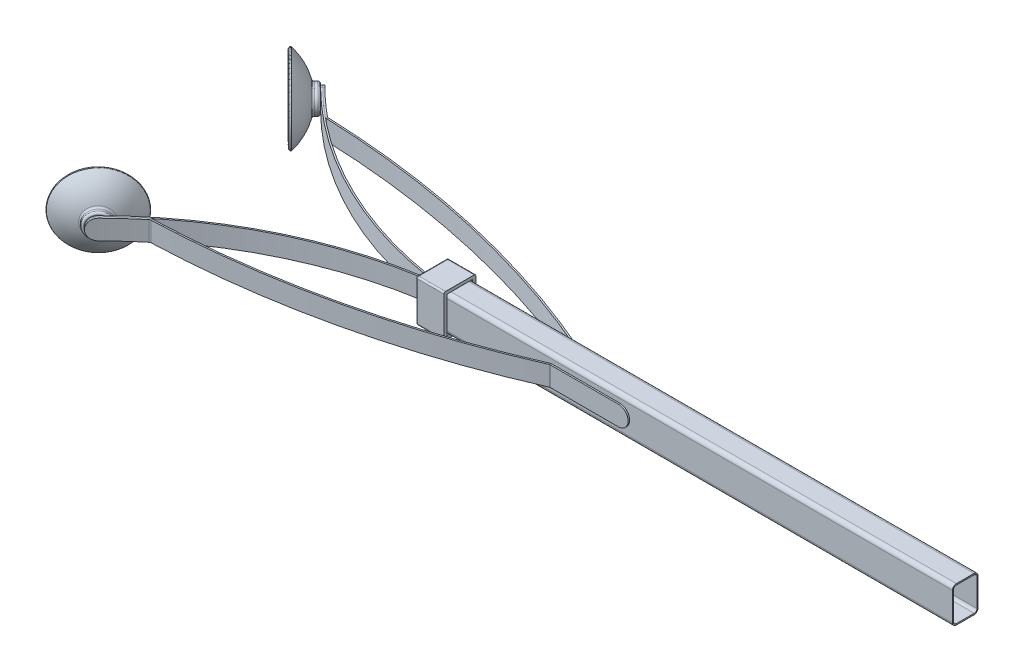
from build123d import *

# Parameters (mm, degrees)
BASE_FLANGE1_DEPTH  = 5
BASE_FLANGE2_START  = -5
BASE_FLANGE2_DEPTH  = 10
FILLET8_RADIUS      = 5
FILLET8_LENGTH      = 0.79375
FILLET1_R           = 5
FILLET2_R           = 5
FILLET3_R           = 1
FILLET4_R           = 0.5
SKETCH10_W          = 13
SKETCH10_H          = 18.3
SKETCH10_W_2        = 12
SKETCH10_H_2        = 17
BOSS_EXTRUDE1_DEPTH = 270
FILLET7_R           = 1.4
FILLET5_R           = 2
SKETCH11_W          = 16.175
SKETCH11_H          = 21.475
SKETCH11_W_2        = 13
SKETCH11_H_2        = 18.3
BOSS_EXTRUDE2_DEPTH = 12.7
SKETCH11_2_W        = 16.175
SKETCH11_2_H        = 21.475
SKETCH11_2_W_2      = 13
SKETCH11_2_H_2      = 18.3
BOSS_EXTRUDE3_DEPTH = 1.5875
SKETCH14_W          = 6.35
SKETCH14_H          = 11
CUT_EXTRUDE1_DEPTH  = 280.307383352
FILLET6_R           = 0.79375


# Read off the part's stored shape, not the designer's step: Base-Flange2
# Sheet-metal steps are written as plain solids
with BuildPart() as part:
    # Sketch1 → Base-Flange1 (new, symmetric)
    with BuildSketch(Plane(origin=(0, 0, 0), x_dir=(1, 0, 0), z_dir=(0, 1, 0))):
        with BuildLine():
            ThreePointArc((-3.499218789, 60.722026783), (-1.760773287, 58.925077051), (0, 57.15))
            ThreePointArc((0, 57.15), (55.11365592, 18.314959936), (120, 0))
            Line((120, 0), (119.916223127, -0.789316475))
            ThreePointArc((119.916223127, -0.789316475), (54.772361369, 17.598330958), (-0.560026873, 56.587497587))
            ThreePointArc((-0.560026873, 56.587497587), (-2.327788228, 58.369619475), (-4.073133186, 60.173700852))
            Line((-4.073133186, 60.173700852), (-3.499218789, 60.722026783))
        make_face()
    extrude(amount=BASE_FLANGE1_DEPTH, both=True)

    # Fillet1
    fillet1_edges = [part.edges().sort_by_distance(p)[0] for p in [
        (-3.786175987, 5, -60.447863818),
        (-3.786175987, -5, -60.447863818),
    ]]
    fillet(fillet1_edges, radius=FILLET1_R - 0.0001)  # a hair under: the kernel refuses the full size


with BuildPart() as body_2:
    # Base-Flange2 outline → Base-Flange2 (new body)
    with BuildSketch(Plane(origin=(0, 0, 0), x_dir=(1, 0, 0), z_dir=(0, 1, 0)).offset(BASE_FLANGE2_START)):
        with BuildLine():
            Line((180.293144329, 6.5), (219.916223127, 6.5))
            Line((219.916223127, 6.5), (219.916223127, 7.29375))
            Line((219.916223127, 7.29375), (180.293144329, 7.29375))
            ThreePointArc((180.293144329, 7.29375), (180.087709299, 7.315079244), (179.891037816, 7.378157103))
            ThreePointArc((179.891037816, 7.378157103), (99.115322291, 34.084810703), (14.760378946, 45.139452184))
            ThreePointArc((14.760378946, 45.139452184), (14.440735605, 45.204111823), (14.158894169, 45.368179309))
            ThreePointArc((14.158894169, 45.368179309), (5.383698882, 53.068843736), (-2.925304391, 61.270352715))
            Line((-2.925304391, 61.270352715), (-3.499218789, 60.722026783))
            ThreePointArc((-3.499218789, 60.722026783), (4.842892238, 52.487838369), (13.65305285, 44.756490154))
            ThreePointArc((13.65305285, 44.756490154), (14.158605925, 44.462194101), (14.731966169, 44.346210873))
            ThreePointArc((14.731966169, 44.346210873), (98.938378759, 33.311034218), (179.571865772, 6.651405242))
            ThreePointArc((179.571865772, 6.651405242), (179.924645244, 6.538259332), (180.293144329, 6.5))
        make_face()
    extrude(amount=BASE_FLANGE2_DEPTH)

    # Fillet8: full round fillet: the end face becomes a half cylinder, R = half its width
    fillet8_face = Plane((219.916223127, 0, -6.896875), x_dir=(0, 0, -1), z_dir=(1, 0, 0))  # on the end face: x along it, z out of the body
    fillet8_slab = fillet8_face.offset(-FILLET8_RADIUS / 2) * Box(FILLET8_LENGTH, 2 * FILLET8_RADIUS, FILLET8_RADIUS, mode=Mode.PRIVATE)  # the body's end, R deep
    fillet8_round = Plane((214.916223127, 0, -6.896875), x_dir=(1, 0, 0), z_dir=(0, 0, -1)) * Cylinder(FILLET8_RADIUS, FILLET8_LENGTH, mode=Mode.PRIVATE)  # its axis R under the face
    add(fillet8_slab - fillet8_round, mode=Mode.SUBTRACT)

    # Fillet2
    fillet2_edges = [body_2.edges().sort_by_distance(p)[0] for p in [
        (-3.21226159, -5, -60.996189749),
        (-3.21226159, 5, -60.996189749),
    ]]
    fillet(fillet2_edges, radius=FILLET2_R - 0.0001)  # a hair under: the kernel refuses the full size


with BuildPart() as body_3:
    # Sketch9 → Revolve1 (revolve)
    with BuildSketch(Plane(origin=(0, 0, 0), x_dir=(1, 0, 0), z_dir=(0, 1, 0))):
        with BuildLine():
            Line((-7.176683174, 58.941719198), (-5.060046175, 61.067712569))
            Line((-5.060046175, 61.067712569), (-0.560026873, 56.587497587))
            Line((-0.560026873, 56.587497587), (-1.680080618, 55.462492762))
            Line((-1.680080618, 55.462492762), (-5.055095095, 58.822653998))
            Line((-5.055095095, 58.822653998), (-6.942115395, 56.927292322))
            ThreePointArc((-6.942115395, 56.927292322), (-13.941651318, 60.05442689), (-21.572077425, 60.795420258))
            Line((-21.572077425, 60.795420258), (-21.674985128, 62.379581315))
            ThreePointArc((-21.674985128, 62.379581315), (-14.16807269, 61.747693122), (-7.176683174, 58.941719198))
        make_face()
    revolve(axis=Axis((-0.560026873, 0, -56.587497587), (-0.7055456663995247, 0, 0.7086644570068762)))

    # Fillet3
    fillet3_edges = [body_3.edges().sort_by_distance(p)[0] for p in [
        (1.82335543, 0, -49.981289235),
        (-0.192086442, 0, -50.20696985),
        (1.694933858, 0, -52.102331526),
        (3.939992429, 0, -52.107282606),
    ]]
    fillet(fillet3_edges, radius=FILLET3_R)

    # Fillet4
    fillet4_edges = [body_3.edges().sort_by_distance(p)[0] for p in [
        (5.325130684, 0, -35.498291425),
        (3.740531149, 0, -35.594210986),
    ]]
    fillet(fillet4_edges, radius=FILLET4_R)


with BuildPart() as body_4:
    # Sketch10 → Boss-Extrude1 (new body)
    with BuildSketch(Plane(origin=(114.3, 0, 0), x_dir=(0, 0, -1), z_dir=(1, 0, 0))):
        Rectangle(SKETCH10_W, SKETCH10_H)
        Rectangle(SKETCH10_W_2, SKETCH10_H_2, mode=Mode.SUBTRACT)
    extrude(amount=BOSS_EXTRUDE1_DEPTH)

    # Fillet7
    fillet7_edges = [body_4.edges().sort_by_distance(p)[0] for p in [
        (249.3, -8.5, 6),
        (249.3, -8.5, -6),
        (249.3, 8.5, -6),
        (249.3, 8.5, 6),
    ]]
    fillet(fillet7_edges, radius=FILLET7_R)

    # Fillet5
    fillet5_edges = [body_4.edges().sort_by_distance(p)[0] for p in [
        (249.3, -9.15, -6.5),
        (249.3, -9.15, 6.5),
        (249.3, 9.15, 6.5),
        (249.3, 9.15, -6.5),
    ]]
    fillet(fillet5_edges, radius=FILLET5_R)


with BuildPart() as body_5:
    # Sketch11 → Boss-Extrude2 (new body)
    with BuildSketch(Plane(origin=(114.3, 0, 0), x_dir=(0, 0, -1), z_dir=(1, 0, 0))):
        Rectangle(SKETCH11_W, SKETCH11_H)
        Rectangle(SKETCH11_W_2, SKETCH11_H_2, mode=Mode.SUBTRACT)
    extrude(amount=BOSS_EXTRUDE2_DEPTH)

    # Sketch11<2> → Boss-Extrude3 (add)
    # profile 1 of 2: a face of its own
    with BuildSketch(Plane(origin=(114.3, 0, 0), x_dir=(0, 0, -1), z_dir=(1, 0, 0))):
        Rectangle(SKETCH11_2_W, SKETCH11_2_H)
        Rectangle(SKETCH11_2_W_2, SKETCH11_2_H_2, mode=Mode.SUBTRACT)
    # profile 2 of 2: a face of its own
    with BuildSketch(Plane(origin=(114.3, 0, 0), x_dir=(0, 0, -1), z_dir=(1, 0, 0))):
        Rectangle(SKETCH11_2_W_2, SKETCH11_2_H_2)
    extrude(amount=-BOSS_EXTRUDE3_DEPTH)

    # Sketch14 → Cut-Extrude1 (cut, through all)
    with BuildSketch(Plane.ZY.offset(-112.7125)):
        Rectangle(SKETCH14_W, SKETCH14_H)
    extrude(amount=-CUT_EXTRUDE1_DEPTH, mode=Mode.SUBTRACT)

    # Fillet6
    fillet6_edges = [body_5.edges().sort_by_distance(p)[0] for p in [
        (112.7125, 0, -8.0875),
        (112.7125, -10.7375, 0),
        (112.7125, 0, 8.0875),
        (112.7125, 10.7375, 0),
        (112.7125, 0, 3.175),
        (112.7125, 5.5, 0),
        (112.7125, 0, -3.175),
        (112.7125, -5.5, 0),
        (119.85625, 10.7375, 8.0875),
        (119.85625, 10.7375, -8.0875),
        (119.85625, -10.7375, -8.0875),
        (119.85625, -10.7375, 8.0875),
    ]]
    fillet(fillet6_edges, radius=FILLET6_R)


with BuildPart() as body_6:
    # Mirror1: mirrored copy
    add(body_3.part.mirror(Plane.XY))


with BuildPart() as body_7:
    # Mirror2: mirrored copy
    add(part.part.mirror(Plane.XY))


with BuildPart() as body_8:
    # Mirror2 2: mirrored copy
    add(body_2.part.mirror(Plane.XY))


solid = Compound([part.part, body_2.part, body_3.part, body_4.part, body_5.part, body_6.part, body_7.part, body_8.part])
